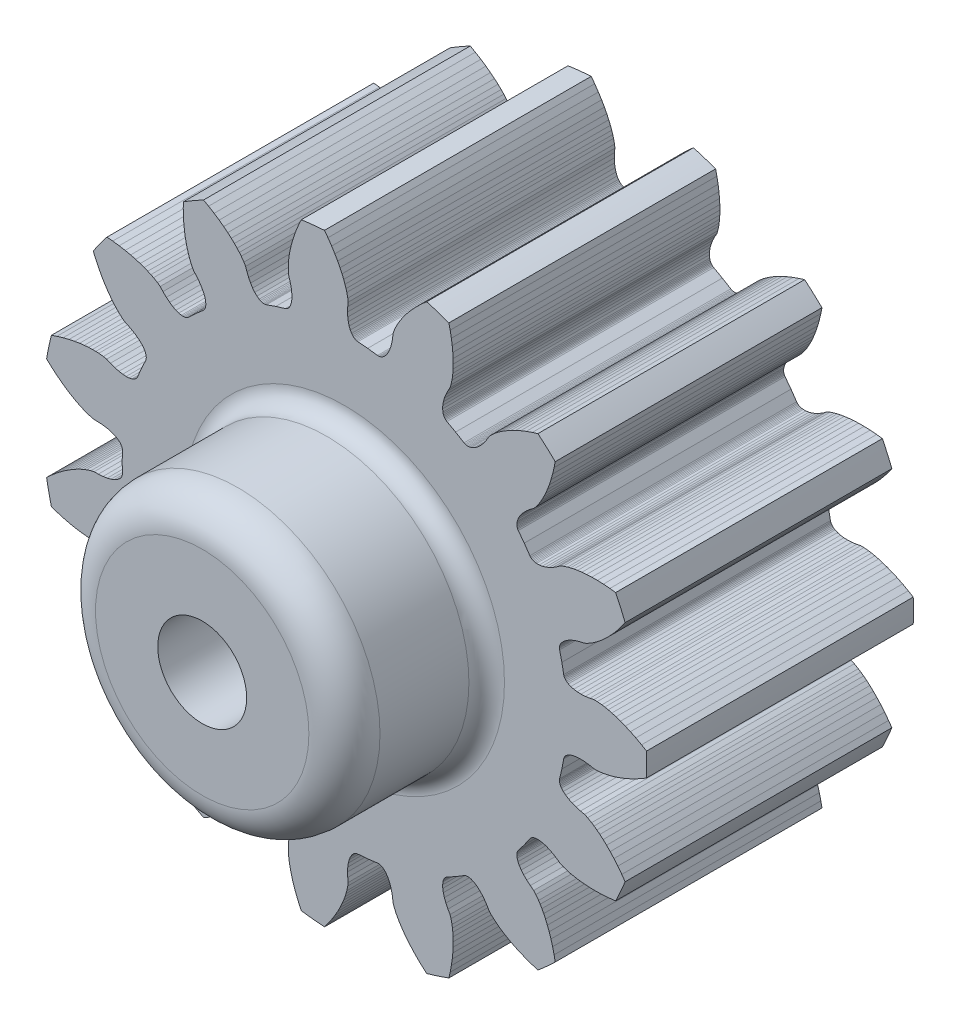
from build123d import *

# Parameters (mm, degrees)
SKETCH1_R           = 2.5
BOSS_EXTRUDE1_DEPTH = 15
SKETCH2_R           = 8
SKETCH2_R_2         = 2.5
BOSS_EXTRUDE2_DEPTH = 8
FILLET1_R           = 2
FILLET2_R           = 1
CUT_EXTRUDE1_REACH  = 84.132
SKETCH3_R           = 1.9


with BuildPart() as part:
    # Sketch1 → Boss-Extrude1 (new body)
    with BuildSketch(Plane.XY):
        with BuildLine():
            Line((75.597629629, 6.043555761), (75.375479429, 5.753315661))
            Line((75.375479429, 5.753315661), (75.157755329, 5.492273861))
            Line((75.157755329, 5.492273861), (74.944995729, 5.257896961))
            Line((74.944995729, 5.257896961), (74.741114529, 5.051395161))
            Line((74.741114529, 5.051395161), (74.547026629, 4.870580761))
            Line((74.547026629, 4.870580761), (74.362927029, 4.712949661))
            Line((74.362927029, 4.712949661), (74.194141129, 4.580237061))
            Line((74.194141129, 4.580237061), (74.038535129, 4.468053261))
            Line((74.038535129, 4.468053261), (73.898532829, 4.375768461))
            Line((73.898532829, 4.375768461), (73.673048429, 4.246083661))
            Line((73.673048429, 4.246083661), (73.505387029, 4.168683561))
            Line((73.505387029, 4.168683561), (73.275858929, 4.119394961))
            Line((73.275858929, 4.119394961), (73.022759329, 4.047194761))
            Line((73.022759329, 4.047194761), (72.799120629, 3.962118561))
            Line((72.799120629, 3.962118561), (72.605538229, 3.866511261))
            Line((72.605538229, 3.866511261), (72.442428929, 3.762741361))
            Line((72.442428929, 3.762741361), (72.310122729, 3.653199561))
            Line((72.310122729, 3.653199561), (72.208743829, 3.540284261))
            Line((72.208743829, 3.540284261), (72.169666629, 3.483304461))
            Line((72.169666629, 3.483304461), (72.138318329, 3.426372761))
            Line((72.138318329, 3.426372761), (72.114663929, 3.369798461))
            Line((72.114663929, 3.369798461), (72.098691929, 3.313875561))
            Line((72.098691929, 3.313875561), (72.090342029, 3.258887961))
            Line((72.090342029, 3.258887961), (72.089579129, 3.205144961))
            Line((72.089579129, 3.205144961), (72.099191729, 3.140153261))
            Line((72.099191729, 3.140153261), (72.226844929, 2.598896061))
            Line((72.226844929, 2.598896061), (72.330377029, 2.052511861))
            Line((72.330377029, 2.052511861), (72.348030029, 1.989229161))
            Line((72.348030029, 1.989229161), (72.370586129, 1.940442761))
            Line((72.370586129, 1.940442761), (72.400579629, 1.893605261))
            Line((72.400579629, 1.893605261), (72.437916729, 1.849013661))
            Line((72.437916729, 1.849013661), (72.482536929, 1.806951561))
            Line((72.482536929, 1.806951561), (72.534331229, 1.767692261))
            Line((72.534331229, 1.767692261), (72.593205729, 1.731532861))
            Line((72.593205729, 1.731532861), (72.731746829, 1.669614061))
            Line((72.731746829, 1.669614061), (72.897169229, 1.623356461))
            Line((72.897169229, 1.623356461), (73.088384029, 1.594900461))
            Line((73.088384029, 1.594900461), (73.304117329, 1.586295861))
            Line((73.304117329, 1.586295861), (73.543025129, 1.599536961))
            Line((73.543025129, 1.599536961), (73.803609529, 1.636523761))
            Line((73.803609529, 1.636523761), (74.033341329, 1.684853761))
            Line((74.033341329, 1.684853761), (74.217989129, 1.682339261))
            Line((74.217989129, 1.682339261), (74.476726929, 1.655579161))
            Line((74.476726929, 1.655579161), (74.642160929, 1.628216861))
            Line((74.642160929, 1.628216861), (74.829943429, 1.589022561))
            Line((74.829943429, 1.589022561), (75.038116029, 1.536434861))
            Line((75.038116029, 1.536434861), (75.270413829, 1.467311861))
            Line((75.270413829, 1.467311861), (75.521265729, 1.381072361))
            Line((75.521265729, 1.381072361), (75.791512329, 1.275349461))
            Line((75.791512329, 1.275349461), (76.081207529, 1.147772661))
            Line((76.081207529, 1.147772661), (76.386283729, 0.997855461))
            Line((76.386283729, 0.997855461), (76.707279329, 0.823064561))
            Line((76.707279329, 0.823064561), (76.987296229, 0.655979061))
            ThreePointArc((76.987296229, 0.655979061), (76.999957078, -3.9e-08), (76.987296229, -0.655979139))
            Line((76.987296229, -0.655979139), (76.707279378, -0.823064639))
            Line((76.707279378, -0.823064639), (76.386283778, -0.997855539))
            Line((76.386283778, -0.997855539), (76.081207578, -1.147772739))
            Line((76.081207578, -1.147772739), (75.791512378, -1.275349539))
            Line((75.791512378, -1.275349539), (75.521265778, -1.381072439))
            Line((75.521265778, -1.381072439), (75.270413878, -1.467311939))
            Line((75.270413878, -1.467311939), (75.038116078, -1.536434939))
            Line((75.038116078, -1.536434939), (74.829943478, -1.589022639))
            Line((74.829943478, -1.589022639), (74.642160978, -1.628216939))
            Line((74.642160978, -1.628216939), (74.476726978, -1.655579239))
            Line((74.476726978, -1.655579239), (74.217989178, -1.682339339))
            Line((74.217989178, -1.682339339), (74.033341378, -1.684853839))
            Line((74.033341378, -1.684853839), (73.803609578, -1.636523839))
            Line((73.803609578, -1.636523839), (73.543025178, -1.599537039))
            Line((73.543025178, -1.599537039), (73.304117378, -1.586295939))
            Line((73.304117378, -1.586295939), (73.088384078, -1.594900539))
            Line((73.088384078, -1.594900539), (72.897169278, -1.623356539))
            Line((72.897169278, -1.623356539), (72.731746878, -1.669614139))
            Line((72.731746878, -1.669614139), (72.593205778, -1.731532939))
            Line((72.593205778, -1.731532939), (72.534331278, -1.767692339))
            Line((72.534331278, -1.767692339), (72.482536978, -1.806951639))
            Line((72.482536978, -1.806951639), (72.437916778, -1.849013739))
            Line((72.437916778, -1.849013739), (72.400579678, -1.893605339))
            Line((72.400579678, -1.893605339), (72.370586178, -1.940442839))
            Line((72.370586178, -1.940442839), (72.348030078, -1.989229239))
            Line((72.348030078, -1.989229239), (72.330377078, -2.052511939))
            Line((72.330377078, -2.052511939), (72.226844978, -2.598896139))
            Line((72.226844978, -2.598896139), (72.099191778, -3.140153339))
            Line((72.099191778, -3.140153339), (72.089579178, -3.205145039))
            Line((72.089579178, -3.205145039), (72.090342078, -3.258888039))
            Line((72.090342078, -3.258888039), (72.098691978, -3.313875639))
            Line((72.098691978, -3.313875639), (72.114663978, -3.369798539))
            Line((72.114663978, -3.369798539), (72.138318378, -3.426372839))
            Line((72.138318378, -3.426372839), (72.169666678, -3.483304539))
            Line((72.169666678, -3.483304539), (72.208743878, -3.540284339))
            Line((72.208743878, -3.540284339), (72.310122778, -3.653199639))
            Line((72.310122778, -3.653199639), (72.442428978, -3.762741439))
            Line((72.442428978, -3.762741439), (72.605538278, -3.866511339))
            Line((72.605538278, -3.866511339), (72.799120678, -3.962118639))
            Line((72.799120678, -3.962118639), (73.022759378, -4.047194839))
            Line((73.022759378, -4.047194839), (73.275858978, -4.119395039))
            Line((73.275858978, -4.119395039), (73.505387078, -4.168683639))
            Line((73.505387078, -4.168683639), (73.673048478, -4.246083739))
            Line((73.673048478, -4.246083739), (73.898532878, -4.375768539))
            Line((73.898532878, -4.375768539), (74.038535178, -4.468053339))
            Line((74.038535178, -4.468053339), (74.194141178, -4.580237139))
            Line((74.194141178, -4.580237139), (74.362927078, -4.712949739))
            Line((74.362927078, -4.712949739), (74.547026678, -4.870580839))
            Line((74.547026678, -4.870580839), (74.741114578, -5.051395239))
            Line((74.741114578, -5.051395239), (74.944995778, -5.257897039))
            Line((74.944995778, -5.257897039), (75.157755378, -5.492273939))
            Line((75.157755378, -5.492273939), (75.375479478, -5.753315739))
            Line((75.375479478, -5.753315739), (75.597629678, -6.043555839))
            Line((75.597629678, -6.043555839), (75.785478078, -6.310089139))
            ThreePointArc((75.785478078, -6.310089139), (75.530233591, -6.914505522), (75.25185658, -7.508622641))
            Line((75.25185658, -7.508622641), (74.928088625, -7.547369759))
            Line((74.928088625, -7.547369759), (74.563750725, -7.576488459))
            Line((74.563750725, -7.576488459), (74.224073025, -7.589358959))
            Line((74.224073025, -7.589358959), (73.907533025, -7.588076559))
            Line((73.907533025, -7.588076559), (73.617649125, -7.574739959))
            Line((73.617649125, -7.574739959), (73.353407725, -7.551493059))
            Line((73.353407725, -7.551493059), (73.113078325, -7.520156059))
            Line((73.113078325, -7.520156059), (72.901513825, -7.483525859))
            Line((72.901513825, -7.483525859), (72.714024225, -7.442953659))
            Line((72.714024225, -7.442953659), (72.551763425, -7.400662159))
            Line((72.551763425, -7.400662159), (72.304510425, -7.319870659))
            Line((72.304510425, -7.319870659), (72.134803525, -7.247064759))
            Line((72.134803525, -7.247064759), (71.944590625, -7.109472759))
            Line((71.944590625, -7.109472759), (71.721578825, -6.969694359))
            Line((71.721578825, -6.969694359), (71.508711425, -6.860425559))
            Line((71.508711425, -6.860425559), (71.308129425, -6.780539559))
            Line((71.308129425, -6.780539559), (71.121871825, -6.728761359))
            Line((71.121871825, -6.728761359), (70.951936325, -6.703736459))
            Line((70.951936325, -6.703736459), (70.800188125, -6.703952359))
            Line((70.800188125, -6.703952359), (70.731696225, -6.713039159))
            Line((70.731696225, -6.713039159), (70.668411625, -6.727837659))
            Line((70.668411625, -6.727837659), (70.610540725, -6.748114659))
            Line((70.610540725, -6.748114659), (70.558294625, -6.773664759))
            Line((70.558294625, -6.773664759), (70.511843725, -6.804253559))
            Line((70.511843725, -6.804253559), (70.471394425, -6.839647659))
            Line((70.471394425, -6.839647659), (70.429528225, -6.890279159))
            Line((70.429528225, -6.890279159), (70.112712425, -7.347315759))
            Line((70.112712425, -7.347315759), (69.775946325, -7.789857459))
            Line((69.775946325, -7.789857459), (69.740730325, -7.845320559))
            Line((69.740730325, -7.845320559), (69.719567925, -7.894727559))
            Line((69.719567925, -7.894727559), (69.704830425, -7.948357459))
            Line((69.704830425, -7.948357459), (69.696675725, -8.005941859))
            Line((69.696675725, -8.005941859), (69.695274325, -8.067246259))
            Line((69.695274325, -8.067246259), (69.700756125, -8.132006459))
            Line((69.700756125, -8.132006459), (69.713279125, -8.199954159))
            Line((69.713279125, -8.199954159), (69.759966625, -8.344341959))
            Line((69.759966625, -8.344341959), (69.836279725, -8.498227159))
            Line((69.836279725, -8.498227159), (69.943080525, -8.659368259))
            Line((69.943080525, -8.659368259), (70.081039825, -8.825446959))
            Line((70.081039825, -8.825446959), (70.250740325, -8.994129959))
            Line((70.250740325, -8.994129959), (70.452591825, -9.163032959))
            Line((70.452591825, -9.163032959), (70.642228625, -9.301417859))
            Line((70.642228625, -9.301417859), (70.763913525, -9.440320359))
            Line((70.763913525, -9.440320359), (70.917156225, -9.650506059))
            Line((70.917156225, -9.650506059), (71.007519025, -9.791756459))
            Line((71.007519025, -9.791756459), (71.104043025, -9.957532159))
            Line((71.104043025, -9.957532159), (71.204257425, -10.147422559))
            Line((71.204257425, -10.147422559), (71.308326525, -10.366305859))
            Line((71.308326525, -10.366305859), (71.412090825, -10.610430659))
            Line((71.412090825, -10.610430659), (71.514353625, -10.882005359))
            Line((71.514353625, -10.882005359), (71.613389525, -11.182656459))
            Line((71.613389525, -11.182656459), (71.706115225, -11.509686359))
            Line((71.706115225, -11.509686359), (71.791008225, -11.865190559))
            Line((71.791008225, -11.865190559), (71.854207325, -12.185085659))
            ThreePointArc((71.854207325, -12.185085659), (71.375191584, -12.633430207), (70.879232318, -13.062957064))
            Line((70.879232318, -13.062957064), (70.56769582, -12.966666054))
            Line((70.56769582, -12.966666054), (70.22301292, -12.845077754))
            Line((70.22301292, -12.845077754), (69.90746692, -12.718676054))
            Line((69.90746692, -12.718676054), (69.61881492, -12.588756154))
            Line((69.61881492, -12.588756154), (69.35941722, -12.458666254))
            Line((69.35941722, -12.458666254), (69.12747612, -12.329952354))
            Line((69.12747612, -12.329952354), (68.92067012, -12.203573854))
            Line((68.92067012, -12.203573854), (68.74229522, -12.084059454))
            Line((68.74229522, -12.084059454), (68.58751712, -11.970736054))
            Line((68.58751712, -11.970736054), (68.45648602, -11.866103454))
            Line((68.45648602, -11.866103454), (68.26347002, -11.691729854))
            Line((68.26347002, -11.691729854), (68.13804782, -11.556192354))
            Line((68.13804782, -11.556192354), (68.02024352, -11.353129254))
            Line((68.02024352, -11.353129254), (67.87336502, -11.134728254))
            Line((67.87336502, -11.134728254), (67.72334462, -10.948325254))
            Line((67.72334462, -10.948325254), (67.57259642, -10.793761754))
            Line((67.57259642, -10.793761754), (67.42350172, -10.670702254))
            Line((67.42350172, -10.670702254), (67.27843652, -10.578721754))
            Line((67.27843652, -10.578721754), (67.13971982, -10.517197454))
            Line((67.13971982, -10.517197454), (67.07345332, -10.497640554))
            Line((67.07345332, -10.497640554), (67.00962082, -10.485419454))
            Line((67.00962082, -10.485419454), (66.94850582, -10.480405154))
            Line((66.94850582, -10.480405154), (66.89038442, -10.482495954))
            Line((66.89038442, -10.482495954), (66.83550782, -10.491546854))
            Line((66.83550782, -10.491546854), (66.78415942, -10.507428854))
            Line((66.78415942, -10.507428854), (66.72531912, -10.536654554))
            Line((66.72531912, -10.536654554), (66.25000002, -10.825317554))
            Line((66.25000002, -10.825317554), (65.76235092, -11.092624554))
            Line((65.76235092, -11.092624554), (65.70762062, -11.128968854))
            Line((65.70762062, -11.128968854), (65.66819222, -11.165496854))
            Line((65.66819222, -11.165496854), (65.63291562, -11.208495954))
            Line((65.63291562, -11.208495954), (65.60204422, -11.257785154))
            Line((65.60204422, -11.257785154), (65.57582922, -11.313219454))
            Line((65.57582922, -11.313219454), (65.55449672, -11.374610554))
            Line((65.55449672, -11.374610554), (65.53830022, -11.441777454))
            Line((65.53830022, -11.441777454), (65.52222352, -11.592671754))
            Line((65.52222352, -11.592671754), (65.52934832, -11.764292254))
            Line((65.52934832, -11.764292254), (65.56137362, -11.954941754))
            Line((65.56137362, -11.954941754), (65.61985542, -12.162775254))
            Line((65.61985542, -12.162775254), (65.70627502, -12.385898254))
            Line((65.70627502, -12.385898254), (65.82197652, -12.622299254))
            Line((65.82197652, -12.622299254), (65.93893222, -12.825852354))
            Line((65.93893222, -12.825852354), (65.99360002, -13.002239854))
            Line((65.99360002, -13.002239854), (66.04810402, -13.256583454))
            Line((66.04810402, -13.256583454), (66.07320292, -13.422376054))
            Line((66.07320292, -13.422376054), (66.09395482, -13.613079454))
            Line((66.09395482, -13.613079454), (66.10826992, -13.827313854))
            Line((66.10826992, -13.827313854), (66.11431392, -14.069602354))
            Line((66.11431392, -14.069602354), (66.10981282, -14.334826254))
            Line((66.10981282, -14.334826254), (66.09277512, -14.624516154))
            Line((66.09277512, -14.624516154), (66.06096312, -14.939456054))
            Line((66.06096312, -14.939456054), (66.01265712, -15.275927754))
            Line((66.01265712, -15.275927754), (65.94561422, -15.635226054))
            Line((65.94561422, -15.635226054), (65.87323642, -15.953170154))
            ThreePointArc((65.87323642, -15.953170154), (65.253275643, -16.167920036), (64.62549003, -16.358587552))
            Line((64.62549003, -16.358587552), (64.380052313, -16.143907932))
            Line((64.380052313, -16.143907932), (64.114623213, -15.892636332))
            Line((64.114623213, -15.892636332), (63.877769813, -15.648818532))
            Line((63.877769813, -15.648818532), (63.666916313, -15.412725432))
            Line((63.666916313, -15.412725432), (63.482857013, -15.188375832))
            Line((63.482857013, -15.188375832), (63.323320913, -14.976450932))
            Line((63.323320913, -14.976450932), (63.185797013, -14.776882832))
            Line((63.185797013, -14.776882832), (63.071454313, -14.595149432))
            Line((63.071454313, -14.595149432), (62.976150313, -14.428669332))
            Line((62.976150313, -14.428669332), (62.899005313, -14.279787632))
            Line((62.899005313, -14.279787632), (62.793600513, -14.041982732))
            Line((62.793600513, -14.041982732), (62.734149813, -13.867149232))
            Line((62.734149813, -13.867149232), (62.709123313, -13.633726532))
            Line((62.709123313, -13.633726532), (62.663774913, -13.374466432))
            Line((62.663774913, -13.374466432), (62.602541313, -13.143160032))
            Line((62.602541313, -13.143160032), (62.527692613, -12.940644432))
            Line((62.527692613, -12.940644432), (62.441540713, -12.767581732))
            Line((62.441540713, -12.767581732), (62.346428813, -12.624550032))
            Line((62.346428813, -12.624550032), (62.244729013, -12.511923632))
            Line((62.244729013, -12.511923632), (62.192146113, -12.467104432))
            Line((62.192146113, -12.467104432), (62.138803013, -12.429976932))
            Line((62.138803013, -12.429976932), (62.085011113, -12.400538432))
            Line((62.085011113, -12.400538432), (62.031064213, -12.378808432))
            Line((62.031064213, -12.378808432), (61.977250613, -12.364756532))
            Line((61.977250613, -12.364756532), (61.923881713, -12.358380132))
            Line((61.923881713, -12.358380132), (61.858241313, -12.361146532))
            Line((61.858241313, -12.361146532), (61.306605813, -12.431523732))
            Line((61.306605813, -12.431523732), (60.752392613, -12.477375932))
            Line((60.752392613, -12.477375932), (60.687611413, -12.488317332))
            Line((60.687611413, -12.488317332), (60.636734513, -12.505650432))
            Line((60.636734513, -12.505650432), (60.587018413, -12.530583732))
            Line((60.587018413, -12.530583732), (60.538768313, -12.563055132))
            Line((60.538768313, -12.563055132), (60.492272513, -12.603034232))
            Line((60.492272513, -12.603034232), (60.447814313, -12.650441132))
            Line((60.447814313, -12.650441132), (60.405698913, -12.705213432))
            Line((60.405698913, -12.705213432), (60.329637813, -12.836523332))
            Line((60.329637813, -12.836523332), (60.266342313, -12.996204232))
            Line((60.266342313, -12.996204232), (60.218054813, -13.183397132))
            Line((60.218054813, -13.183397132), (60.186947113, -13.397049132))
            Line((60.186947113, -13.397049132), (60.175142913, -13.636032232))
            Line((60.175142913, -13.636032232), (60.184688613, -13.899055332))
            Line((60.184688613, -13.899055332), (60.208740413, -14.132580432))
            Line((60.208740413, -14.132580432), (60.186938713, -14.315953932))
            Line((60.186938713, -14.315953932), (60.133279713, -14.570477132))
            Line((60.133279713, -14.570477132), (60.088774813, -14.732144732))
            Line((60.088774813, -14.732144732), (60.030166513, -14.914801632))
            Line((60.030166513, -14.914801632), (59.956107013, -15.116336932))
            Line((59.956107013, -15.116336932), (59.863080913, -15.340136832))
            Line((59.863080913, -15.340136832), (59.751092613, -15.580600132))
            Line((59.751092613, -15.580600132), (59.617700513, -15.838315132))
            Line((59.617700513, -15.838315132), (59.460541113, -16.113088032))
            Line((59.460541113, -16.113088032), (59.279556113, -16.400822332))
            Line((59.279556113, -16.400822332), (59.072169613, -16.701788832))
            Line((59.072169613, -16.701788832), (58.876729613, -16.962806632))
            ThreePointArc((58.876729613, -16.962806632), (58.223020594, -16.906829626), (57.571958414, -16.825669634))
            Line((57.571958414, -16.825669634), (57.435058013, -16.52972153))
            Line((57.435058013, -16.52972153), (57.294777813, -16.19221373))
            Line((57.294777813, -16.19221373), (57.177571013, -15.87313823))
            Line((57.177571013, -15.87313823), (57.080974513, -15.57169453))
            Line((57.080974513, -15.57169453), (57.004079213, -15.29187733))
            Line((57.004079213, -15.29187733), (56.944533313, -15.03338513))
            Line((56.944533313, -15.03338513), (56.900070613, -14.79513463))
            Line((56.900070613, -14.79513463), (56.869531113, -14.58260543))
            Line((56.869531113, -14.58260543), (56.850180113, -14.39175473))
            Line((56.850180113, -14.39175473), (56.840260313, -14.22436683))
            Line((56.840260313, -14.22436683), (56.840692213, -13.96424923))
            Line((56.840692213, -13.96424923), (56.857492413, -13.78035013))
            Line((56.857492413, -13.78035013), (56.929571213, -13.55692863))
            Line((56.929571213, -13.55692863), (56.993593813, -13.30163793))
            Line((56.993593813, -13.30163793), (57.031735013, -13.06542303))
            Line((57.031735013, -13.06542303), (57.045727913, -12.84997213))
            Line((57.045727913, -12.84997213), (57.037415113, -12.65683033))
            Line((57.037415113, -12.65683033), (57.008702313, -12.48747893))
            Line((57.008702313, -12.48747893), (56.961604213, -12.34322453))
            Line((56.961604213, -12.34322453), (56.931796913, -12.28089283))
            Line((56.931796913, -12.28089283), (56.898166713, -12.22527853))
            Line((56.898166713, -12.22527853), (56.860999113, -12.17650603))
            Line((56.860999113, -12.17650603), (56.820554513, -12.13471243))
            Line((56.820554513, -12.13471243), (56.777108713, -12.09998743))
            Line((56.777108713, -12.09998743), (56.730947413, -12.07245523))
            Line((56.730947413, -12.07245523), (56.669856613, -12.04828413))
            Line((56.669856613, -12.04828413), (56.137287613, -11.88820653))
            Line((56.137287613, -11.88820653), (55.612338913, -11.70467573))
            Line((55.612338913, -11.70467573), (55.548708013, -11.68832233))
            Line((55.548708013, -11.68832233), (55.495179713, -11.68346343))
            Line((55.495179713, -11.68346343), (55.439620413, -11.68601973))
            Line((55.439620413, -11.68601973), (55.382334413, -11.69605873))
            Line((55.382334413, -11.69605873), (55.323597513, -11.71367003))
            Line((55.323597513, -11.71367003), (55.263700813, -11.73889553))
            Line((55.263700813, -11.73889553), (55.202948513, -11.77180263))
            Line((55.202948513, -11.77180263), (55.080054813, -11.86082333))
            Line((55.080054813, -11.86082333), (54.957283313, -11.98095453))
            Line((54.957283313, -11.98095453), (54.837032313, -12.13232343))
            Line((54.837032313, -12.13232343), (54.721713913, -12.31485163))
            Line((54.721713913, -12.31485163), (54.613727113, -12.52837233))
            Line((54.613727113, -12.52837233), (54.515466413, -12.77253843))
            Line((54.515466413, -12.77253843), (54.442455513, -12.99565703))
            Line((54.442455513, -12.99565703), (54.347954013, -13.15430953))
            Line((54.347954013, -13.15430953), (54.195410113, -13.36500293))
            Line((54.195410113, -13.36500293), (54.088996713, -13.49459193))
            Line((54.088996713, -13.49459193), (53.961162213, -13.63761913))
            Line((53.961162213, -13.63761913), (53.811533613, -13.79160813))
            Line((53.811533613, -13.79160813), (53.635522413, -13.95822233))
            Line((53.635522413, -13.95822233), (53.435410813, -14.13234673))
            Line((53.435410813, -14.13234673), (53.208728913, -14.31352563))
            Line((53.208728913, -14.31352563), (52.953396513, -14.50062063))
            Line((52.953396513, -14.50062063), (52.671026313, -14.68986583))
            Line((52.671026313, -14.68986583), (52.359155213, -14.88046073))
            Line((52.359155213, -14.88046073), (52.074446413, -15.03941973))
            ThreePointArc((52.074446413, -15.03941973), (51.500021442, -14.722394799), (50.93825732, -14.383440634))
            Line((50.93825732, -14.383440634), (50.933565412, -14.057396032))
            Line((50.933565412, -14.057396032), (50.942689912, -13.692010332))
            Line((50.942689912, -13.692010332), (50.965395912, -13.352848032))
            Line((50.965395912, -13.352848032), (50.999758812, -13.038176132))
            Line((50.999758812, -13.038176132), (51.043323312, -12.751274332))
            Line((51.043323312, -12.751274332), (51.094063712, -12.490910432))
            Line((51.094063712, -12.490910432), (51.150350212, -12.255173132))
            Line((51.150350212, -12.255173132), (51.208894312, -12.048596532))
            Line((51.208894312, -12.048596532), (51.268842312, -11.866375032))
            Line((51.268842312, -11.866375032), (51.327862912, -11.709423732))
            Line((51.327862912, -11.709423732), (51.434056812, -11.471970132))
            Line((51.434056812, -11.471970132), (51.524203112, -11.310803232))
            Line((51.524203112, -11.310803232), (51.680924112, -11.136014732))
            Line((51.680924112, -11.136014732), (51.843247812, -10.928835332))
            Line((51.843247812, -10.928835332), (51.974168712, -10.728555732))
            Line((51.974168712, -10.728555732), (52.074583612, -10.537422932))
            Line((52.074583612, -10.537422932), (52.145547412, -10.357598032))
            Line((52.145547412, -10.357598032), (52.188198312, -10.191209232))
            Line((52.188198312, -10.191209232), (52.203845612, -10.040269732))
            Line((52.203845612, -10.040269732), (52.201967912, -9.971203232))
            Line((52.201967912, -9.971203232), (52.193865512, -9.906718432))
            Line((52.193865512, -9.906718432), (52.179748812, -9.847045032))
            Line((52.179748812, -9.847045032), (52.159799812, -9.792414432))
            Line((52.159799812, -9.792414432), (52.134234112, -9.743020532))
            Line((52.134234112, -9.743020532), (52.103261912, -9.699093132))
            Line((52.103261912, -9.699093132), (52.057284012, -9.652163932))
            Line((52.057284012, -9.652163932), (51.635867412, -9.289310332))
            Line((51.635867412, -9.289310332), (51.230951612, -8.908130832))
            Line((51.230951612, -8.908130832), (51.179473412, -8.867310232))
            Line((51.179473412, -8.867310232), (51.132549212, -8.841099432))
            Line((51.132549212, -8.841099432), (51.080753512, -8.820836832))
            Line((51.080753512, -8.820836832), (51.024336912, -8.806707532))
            Line((51.024336912, -8.806707532), (50.963514912, -8.798905732))
            Line((50.963514912, -8.798905732), (50.898536412, -8.797588232))
            Line((50.898536412, -8.797588232), (50.829651912, -8.802940232))
            Line((50.829651912, -8.802940232), (50.681174912, -8.834279332))
            Line((50.681174912, -8.834279332), (50.520155912, -8.894088932))
            Line((50.520155912, -8.894088932), (50.348733812, -8.983460832))
            Line((50.348733812, -8.983460832), (50.169144312, -9.103304432))
            Line((50.169144312, -9.103304432), (49.983646712, -9.254443132))
            Line((49.983646712, -9.254443132), (49.794569812, -9.437533732))
            Line((49.794569812, -9.437533732), (49.637120612, -9.611666532))
            Line((49.637120612, -9.611666532), (49.486259412, -9.718165432))
            Line((49.486259412, -9.718165432), (49.261206912, -9.848598332))
            Line((49.261206912, -9.848598332), (49.111284812, -9.923701532))
            Line((49.111284812, -9.923701532), (48.936327712, -10.002368332))
            Line((48.936327712, -10.002368332), (48.737002312, -10.082184932))
            Line((48.737002312, -10.082184932), (48.508439912, -10.162804332))
            Line((48.508439912, -10.162804332), (48.254806212, -10.240482232))
            Line((48.254806212, -10.240482232), (47.974029712, -10.313797532))
            Line((47.974029712, -10.313797532), (47.664673612, -10.380864332))
            Line((47.664673612, -10.380864332), (47.329742712, -10.438898032))
            Line((47.329742712, -10.438898032), (46.967312312, -10.486165732))
            Line((46.967312312, -10.486165732), (46.642563512, -10.515580532))
            ThreePointArc((46.642563512, -10.515580532), (46.246745819, -9.99232412), (45.871413812, -9.454183985))
            Line((45.871413812, -9.454183985), (45.999741816, -9.154419097))
            Line((45.999741816, -9.154419097), (46.156693216, -8.824333897))
            Line((46.156693216, -8.824333897), (46.315385916, -8.523729097))
            Line((46.315385916, -8.523729097), (46.474766516, -8.250238697))
            Line((46.474766516, -8.250238697), (46.631258216, -8.005860097))
            Line((46.631258216, -8.005860097), (46.783511416, -7.788643897))
            Line((46.783511416, -7.788643897), (46.930814716, -7.596180897))
            Line((46.930814716, -7.596180897), (47.068319716, -7.431275797))
            Line((47.068319716, -7.431275797), (47.197201016, -7.289191197))
            Line((47.197201016, -7.289191197), (47.314956916, -7.169814897))
            Line((47.314956916, -7.169814897), (47.508550916, -6.996083197))
            Line((47.508550916, -6.996083197), (47.656456116, -6.885515697))
            Line((47.656456116, -6.885515697), (47.870720716, -6.789582597))
            Line((47.870720716, -6.789582597), (48.103278216, -6.666337897))
            Line((48.103278216, -6.666337897), (48.304341616, -6.536623697))
            Line((48.304341616, -6.536623697), (48.473815816, -6.402857597))
            Line((48.473815816, -6.402857597), (48.611785816, -6.267442897))
            Line((48.611785816, -6.267442897), (48.718425816, -6.132786897))
            Line((48.718425816, -6.132786897), (48.794113016, -6.001261197))
            Line((48.794113016, -6.001261197), (48.820489516, -5.937401997))
            Line((48.820489516, -5.937401997), (48.839315916, -5.875196597))
            Line((48.839315916, -5.875196597), (48.850691016, -5.814940497))
            Line((48.850691016, -5.814940497), (48.854687016, -5.756918997))
            Line((48.854687016, -5.756918997), (48.851421816, -5.701396897))
            Line((48.851421816, -5.701396897), (48.840994216, -5.648669697))
            Line((48.840994216, -5.648669697), (48.818079216, -5.587096797))
            Line((48.818079216, -5.587096797), (48.580681816, -5.084207997))
            Line((48.580681816, -5.084207997), (48.365812416, -4.571289097))
            Line((48.365812416, -4.571289097), (48.335388016, -4.513059597))
            Line((48.335388016, -4.513059597), (48.303181516, -4.470028997))
            Line((48.303181516, -4.470028997), (48.264105416, -4.430450997))
            Line((48.264105416, -4.430450997), (48.218313116, -4.394596597))
            Line((48.218313116, -4.394596597), (48.165922716, -4.362730797))
            Line((48.165922716, -4.362730797), (48.107097816, -4.335097997))
            Line((48.107097816, -4.335097997), (48.041991916, -4.311969397))
            Line((48.041991916, -4.311969397), (47.893604616, -4.280208097))
            Line((47.893604616, -4.280208097), (47.722179616, -4.269354597))
            Line((47.722179616, -4.269354597), (47.529226916, -4.281276197))
            Line((47.529226916, -4.281276197), (47.316418916, -4.317713097))
            Line((47.316418916, -4.317713097), (47.085484916, -4.380336497))
            Line((47.085484916, -4.380336497), (46.838284916, -4.470693597))
            Line((46.838284916, -4.470693597), (46.623621616, -4.565731497))
            Line((46.623621616, -4.565731497), (46.442486016, -4.601662297))
            Line((46.442486016, -4.601662297), (46.183838516, -4.629281597))
            Line((46.183838516, -4.629281597), (46.016330716, -4.636912897))
            Line((46.016330716, -4.636912897), (45.824502716, -4.637617197))
            Line((45.824502716, -4.637617197), (45.609945616, -4.629460297))
            Line((45.609945616, -4.629460297), (45.368352616, -4.610145097))
            Line((45.368352616, -4.610145097), (45.105052216, -4.577945197))
            Line((45.105052216, -4.577945197), (44.818730116, -4.530720097))
            Line((44.818730116, -4.530720097), (44.508840716, -4.466162097))
            Line((44.508840716, -4.466162097), (44.179261716, -4.382949897))
            Line((44.179261716, -4.382949897), (43.828939516, -4.278717397))
            Line((43.828939516, -4.278717397), (43.520302616, -4.173501897))
            ThreePointArc((43.520302616, -4.173501897), (43.371532736, -3.534489832), (43.247531217, -2.890213091))
            Line((43.247531217, -2.890213091), (43.48669, -2.66856))
            Line((43.48669, -2.66856), (43.76433, -2.43085))
            Line((43.76433, -2.43085), (44.03157, -2.22078))
            Line((44.03157, -2.22078), (44.28841, -2.03576))
            Line((44.28841, -2.03576), (44.53077, -1.87616))
            Line((44.53077, -1.87616), (44.75821, -1.73965))
            Line((44.75821, -1.73965), (44.97106, -1.62374))
            Line((44.97106, -1.62374), (45.16375, -1.52902))
            Line((45.16375, -1.52902), (45.33928, -1.45164))
            Line((45.33928, -1.45164), (45.49541, -1.39048))
            Line((45.49541, -1.39048), (45.74293, -1.31051))
            Line((45.74293, -1.31051), (45.92302, -1.26966))
            Line((45.92302, -1.26966), (46.15778, -1.26917))
            Line((46.15778, -1.26917), (46.42036, -1.25117))
            Line((46.42036, -1.25117), (46.6568, -1.21445))
            Line((46.6568, -1.21445), (46.86603, -1.16118))
            Line((46.86603, -1.16118), (47.04715, -1.09359))
            Line((47.04715, -1.09359), (47.19934, -1.01395))
            Line((47.19934, -1.01395), (47.32198, -0.92458))
            Line((47.32198, -0.92458), (47.37205, -0.87697))
            Line((47.37205, -0.87697), (47.41455, -0.8278))
            Line((47.41455, -0.8278), (47.44945, -0.77738))
            Line((47.44945, -0.77738), (47.4767, -0.726))
            Line((47.4767, -0.726), (47.4963, -0.67395))
            Line((47.4963, -0.67395), (47.50822, -0.62154))
            Line((47.50822, -0.62154), (47.51233, -0.55597))
            Line((47.51233, -0.55597), (47.5, 0))
            Line((47.5, 0), (47.51233, 0.55597))
            Line((47.51233, 0.55597), (47.50822, 0.62154))
            Line((47.50822, 0.62154), (47.4963, 0.67395))
            Line((47.4963, 0.67395), (47.4767, 0.726))
            Line((47.4767, 0.726), (47.44945, 0.77738))
            Line((47.44945, 0.77738), (47.41455, 0.8278))
            Line((47.41455, 0.8278), (47.37205, 0.87697))
            Line((47.37205, 0.87697), (47.32198, 0.92458))
            Line((47.32198, 0.92458), (47.19934, 1.01395))
            Line((47.19934, 1.01395), (47.04715, 1.09359))
            Line((47.04715, 1.09359), (46.86603, 1.16118))
            Line((46.86603, 1.16118), (46.6568, 1.21445))
            Line((46.6568, 1.21445), (46.42036, 1.25117))
            Line((46.42036, 1.25117), (46.15778, 1.26917))
            Line((46.15778, 1.26917), (45.92302, 1.26966))
            Line((45.92302, 1.26966), (45.74293, 1.31051))
            Line((45.74293, 1.31051), (45.49541, 1.39048))
            Line((45.49541, 1.39048), (45.33928, 1.45164))
            Line((45.33928, 1.45164), (45.16375, 1.52902))
            Line((45.16375, 1.52902), (44.97106, 1.62374))
            Line((44.97106, 1.62374), (44.75821, 1.73965))
            Line((44.75821, 1.73965), (44.53077, 1.87616))
            Line((44.53077, 1.87616), (44.28841, 2.03576))
            Line((44.28841, 2.03576), (44.03157, 2.22078))
            Line((44.03157, 2.22078), (43.76433, 2.43085))
            Line((43.76433, 2.43085), (43.48669, 2.66856))
            Line((43.48669, 2.66856), (43.2475312, 2.8902131))
            ThreePointArc((43.2475312, 2.8902131), (43.371532719, 3.534489839), (43.520302598, 4.173501902))
            Line((43.520302598, 4.173501902), (43.828939482, 4.278717404))
            Line((43.828939482, 4.278717404), (44.179261682, 4.382949904))
            Line((44.179261682, 4.382949904), (44.508840682, 4.466162104))
            Line((44.508840682, 4.466162104), (44.818730082, 4.530720104))
            Line((44.818730082, 4.530720104), (45.105052182, 4.577945204))
            Line((45.105052182, 4.577945204), (45.368352582, 4.610145104))
            Line((45.368352582, 4.610145104), (45.609945582, 4.629460304))
            Line((45.609945582, 4.629460304), (45.824502682, 4.637617204))
            Line((45.824502682, 4.637617204), (46.016330682, 4.636912904))
            Line((46.016330682, 4.636912904), (46.183838482, 4.629281604))
            Line((46.183838482, 4.629281604), (46.442485982, 4.601662304))
            Line((46.442485982, 4.601662304), (46.623621582, 4.565731504))
            Line((46.623621582, 4.565731504), (46.838284882, 4.470693604))
            Line((46.838284882, 4.470693604), (47.085484882, 4.380336504))
            Line((47.085484882, 4.380336504), (47.316418882, 4.317713104))
            Line((47.316418882, 4.317713104), (47.529226882, 4.281276204))
            Line((47.529226882, 4.281276204), (47.722179582, 4.269354604))
            Line((47.722179582, 4.269354604), (47.893604582, 4.280208104))
            Line((47.893604582, 4.280208104), (48.041991882, 4.311969404))
            Line((48.041991882, 4.311969404), (48.107097782, 4.335098004))
            Line((48.107097782, 4.335098004), (48.165922682, 4.362730804))
            Line((48.165922682, 4.362730804), (48.218313082, 4.394596604))
            Line((48.218313082, 4.394596604), (48.264105382, 4.430451004))
            Line((48.264105382, 4.430451004), (48.303181482, 4.470029004))
            Line((48.303181482, 4.470029004), (48.335387982, 4.513059604))
            Line((48.335387982, 4.513059604), (48.365812382, 4.571289104))
            Line((48.365812382, 4.571289104), (48.580681782, 5.084208004))
            Line((48.580681782, 5.084208004), (48.818079182, 5.587096804))
            Line((48.818079182, 5.587096804), (48.840994182, 5.648669704))
            Line((48.840994182, 5.648669704), (48.851421782, 5.701396904))
            Line((48.851421782, 5.701396904), (48.854686982, 5.756919004))
            Line((48.854686982, 5.756919004), (48.850690982, 5.814940504))
            Line((48.850690982, 5.814940504), (48.839315882, 5.875196604))
            Line((48.839315882, 5.875196604), (48.820489482, 5.937402004))
            Line((48.820489482, 5.937402004), (48.794112982, 6.001261204))
            Line((48.794112982, 6.001261204), (48.718425782, 6.132786904))
            Line((48.718425782, 6.132786904), (48.611785782, 6.267442904))
            Line((48.611785782, 6.267442904), (48.473815782, 6.402857604))
            Line((48.473815782, 6.402857604), (48.304341582, 6.536623704))
            Line((48.304341582, 6.536623704), (48.103278182, 6.666337904))
            Line((48.103278182, 6.666337904), (47.870720682, 6.789582604))
            Line((47.870720682, 6.789582604), (47.656456082, 6.885515704))
            Line((47.656456082, 6.885515704), (47.508550882, 6.996083204))
            Line((47.508550882, 6.996083204), (47.314956882, 7.169814904))
            Line((47.314956882, 7.169814904), (47.197200982, 7.289191204))
            Line((47.197200982, 7.289191204), (47.068319682, 7.431275804))
            Line((47.068319682, 7.431275804), (46.930814682, 7.596180904))
            Line((46.930814682, 7.596180904), (46.783511382, 7.788643904))
            Line((46.783511382, 7.788643904), (46.631258182, 8.005860104))
            Line((46.631258182, 8.005860104), (46.474766482, 8.250238704))
            Line((46.474766482, 8.250238704), (46.315385882, 8.523729104))
            Line((46.315385882, 8.523729104), (46.156693182, 8.824333904))
            Line((46.156693182, 8.824333904), (45.999741782, 9.154419104))
            Line((45.999741782, 9.154419104), (45.871413782, 9.454184004))
            ThreePointArc((45.871413782, 9.454184004), (46.246745787, 9.992324112), (46.642563476, 10.515580498))
            Line((46.642563476, 10.515580498), (46.967312279, 10.486165706))
            Line((46.967312279, 10.486165706), (47.329742679, 10.438898006))
            Line((47.329742679, 10.438898006), (47.664673579, 10.380864306))
            Line((47.664673579, 10.380864306), (47.974029679, 10.313797506))
            Line((47.974029679, 10.313797506), (48.254806179, 10.240482206))
            Line((48.254806179, 10.240482206), (48.508439879, 10.162804306))
            Line((48.508439879, 10.162804306), (48.737002279, 10.082184906))
            Line((48.737002279, 10.082184906), (48.936327679, 10.002368306))
            Line((48.936327679, 10.002368306), (49.111284779, 9.923701506))
            Line((49.111284779, 9.923701506), (49.261206879, 9.848598306))
            Line((49.261206879, 9.848598306), (49.486259379, 9.718165406))
            Line((49.486259379, 9.718165406), (49.637120579, 9.611666506))
            Line((49.637120579, 9.611666506), (49.794569779, 9.437533706))
            Line((49.794569779, 9.437533706), (49.983646679, 9.254443106))
            Line((49.983646679, 9.254443106), (50.169144279, 9.103304406))
            Line((50.169144279, 9.103304406), (50.348733779, 8.983460806))
            Line((50.348733779, 8.983460806), (50.520155879, 8.894088906))
            Line((50.520155879, 8.894088906), (50.681174879, 8.834279306))
            Line((50.681174879, 8.834279306), (50.829651879, 8.802940206))
            Line((50.829651879, 8.802940206), (50.898536379, 8.797588206))
            Line((50.898536379, 8.797588206), (50.963514879, 8.798905706))
            Line((50.963514879, 8.798905706), (51.024336879, 8.806707506))
            Line((51.024336879, 8.806707506), (51.080753479, 8.820836806))
            Line((51.080753479, 8.820836806), (51.132549179, 8.841099406))
            Line((51.132549179, 8.841099406), (51.179473379, 8.867310206))
            Line((51.179473379, 8.867310206), (51.230951579, 8.908130806))
            Line((51.230951579, 8.908130806), (51.635867379, 9.289310306))
            Line((51.635867379, 9.289310306), (52.057283979, 9.652163906))
            Line((52.057283979, 9.652163906), (52.103261879, 9.699093106))
            Line((52.103261879, 9.699093106), (52.134234079, 9.743020506))
            Line((52.134234079, 9.743020506), (52.159799779, 9.792414406))
            Line((52.159799779, 9.792414406), (52.179748779, 9.847045006))
            Line((52.179748779, 9.847045006), (52.193865479, 9.906718406))
            Line((52.193865479, 9.906718406), (52.201967879, 9.971203206))
            Line((52.201967879, 9.971203206), (52.203845579, 10.040269706))
            Line((52.203845579, 10.040269706), (52.188198279, 10.191209206))
            Line((52.188198279, 10.191209206), (52.145547379, 10.357598006))
            Line((52.145547379, 10.357598006), (52.074583579, 10.537422906))
            Line((52.074583579, 10.537422906), (51.974168679, 10.728555706))
            Line((51.974168679, 10.728555706), (51.843247779, 10.928835306))
            Line((51.843247779, 10.928835306), (51.680924079, 11.136014706))
            Line((51.680924079, 11.136014706), (51.524203079, 11.310803206))
            Line((51.524203079, 11.310803206), (51.434056779, 11.471970106))
            Line((51.434056779, 11.471970106), (51.327862879, 11.709423706))
            Line((51.327862879, 11.709423706), (51.268842279, 11.866375006))
            Line((51.268842279, 11.866375006), (51.208894279, 12.048596506))
            Line((51.208894279, 12.048596506), (51.150350179, 12.255173106))
            Line((51.150350179, 12.255173106), (51.094063679, 12.490910406))
            Line((51.094063679, 12.490910406), (51.043323279, 12.751274306))
            Line((51.043323279, 12.751274306), (50.999758779, 13.038176106))
            Line((50.999758779, 13.038176106), (50.965395879, 13.352848006))
            Line((50.965395879, 13.352848006), (50.942689879, 13.692010306))
            Line((50.942689879, 13.692010306), (50.933565379, 14.057396006))
            Line((50.933565379, 14.057396006), (50.938257279, 14.383440606))
            ThreePointArc((50.938257279, 14.383440606), (51.500021407, 14.722394774), (52.074446384, 15.039419709))
            Line((52.074446384, 15.039419709), (52.359155178, 14.880460709))
            Line((52.359155178, 14.880460709), (52.671026278, 14.689865809))
            Line((52.671026278, 14.689865809), (52.953396478, 14.500620609))
            Line((52.953396478, 14.500620609), (53.208728878, 14.313525609))
            Line((53.208728878, 14.313525609), (53.435410778, 14.132346709))
            Line((53.435410778, 14.132346709), (53.635522378, 13.958222309))
            Line((53.635522378, 13.958222309), (53.811533578, 13.791608109))
            Line((53.811533578, 13.791608109), (53.961162178, 13.637619109))
            Line((53.961162178, 13.637619109), (54.088996678, 13.494591909))
            Line((54.088996678, 13.494591909), (54.195410078, 13.365002909))
            Line((54.195410078, 13.365002909), (54.347953978, 13.154309509))
            Line((54.347953978, 13.154309509), (54.442455478, 12.995657009))
            Line((54.442455478, 12.995657009), (54.515466378, 12.772538409))
            Line((54.515466378, 12.772538409), (54.613727078, 12.528372309))
            Line((54.613727078, 12.528372309), (54.721713878, 12.314851609))
            Line((54.721713878, 12.314851609), (54.837032278, 12.132323409))
            Line((54.837032278, 12.132323409), (54.957283278, 11.980954509))
            Line((54.957283278, 11.980954509), (55.080054778, 11.860823309))
            Line((55.080054778, 11.860823309), (55.202948478, 11.771802609))
            Line((55.202948478, 11.771802609), (55.263700778, 11.738895509))
            Line((55.263700778, 11.738895509), (55.323597478, 11.713670009))
            Line((55.323597478, 11.713670009), (55.382334378, 11.696058709))
            Line((55.382334378, 11.696058709), (55.439620378, 11.686019709))
            Line((55.439620378, 11.686019709), (55.495179678, 11.683463409))
            Line((55.495179678, 11.683463409), (55.548707978, 11.688322309))
            Line((55.548707978, 11.688322309), (55.612338878, 11.704675709))
            Line((55.612338878, 11.704675709), (56.137287578, 11.888206509))
            Line((56.137287578, 11.888206509), (56.669856578, 12.048284109))
            Line((56.669856578, 12.048284109), (56.730947378, 12.072455209))
            Line((56.730947378, 12.072455209), (56.777108678, 12.099987409))
            Line((56.777108678, 12.099987409), (56.820554478, 12.134712409))
            Line((56.820554478, 12.134712409), (56.860999078, 12.176506009))
            Line((56.860999078, 12.176506009), (56.898166678, 12.225278509))
            Line((56.898166678, 12.225278509), (56.931796878, 12.280892809))
            Line((56.931796878, 12.280892809), (56.961604178, 12.343224509))
            Line((56.961604178, 12.343224509), (57.008702278, 12.487478909))
            Line((57.008702278, 12.487478909), (57.037415078, 12.656830309))
            Line((57.037415078, 12.656830309), (57.045727878, 12.849972109))
            Line((57.045727878, 12.849972109), (57.031734978, 13.065423009))
            Line((57.031734978, 13.065423009), (56.993593778, 13.301637909))
            Line((56.993593778, 13.301637909), (56.929571178, 13.556928609))
            Line((56.929571178, 13.556928609), (56.857492378, 13.780350109))
            Line((56.857492378, 13.780350109), (56.840692178, 13.964249209))
            Line((56.840692178, 13.964249209), (56.840260278, 14.224366809))
            Line((56.840260278, 14.224366809), (56.850180078, 14.391754709))
            Line((56.850180078, 14.391754709), (56.869531078, 14.582605409))
            Line((56.869531078, 14.582605409), (56.900070578, 14.795134609))
            Line((56.900070578, 14.795134609), (56.944533278, 15.033385109))
            Line((56.944533278, 15.033385109), (57.004079178, 15.291877309))
            Line((57.004079178, 15.291877309), (57.080974478, 15.571694509))
            Line((57.080974478, 15.571694509), (57.177570978, 15.873138209))
            Line((57.177570978, 15.873138209), (57.294777778, 16.192213709))
            Line((57.294777778, 16.192213709), (57.435057978, 16.529721509))
            Line((57.435057978, 16.529721509), (57.571958378, 16.825669609))
            ThreePointArc((57.571958378, 16.825669609), (58.223020551, 16.9068296), (58.876729563, 16.962806606))
            Line((58.876729563, 16.962806606), (59.072169578, 16.701788805))
            Line((59.072169578, 16.701788805), (59.279556078, 16.400822305))
            Line((59.279556078, 16.400822305), (59.460541078, 16.113088005))
            Line((59.460541078, 16.113088005), (59.617700478, 15.838315105))
            Line((59.617700478, 15.838315105), (59.751092578, 15.580600105))
            Line((59.751092578, 15.580600105), (59.863080878, 15.340136805))
            Line((59.863080878, 15.340136805), (59.956106978, 15.116336905))
            Line((59.956106978, 15.116336905), (60.030166478, 14.914801605))
            Line((60.030166478, 14.914801605), (60.088774778, 14.732144705))
            Line((60.088774778, 14.732144705), (60.133279678, 14.570477105))
            Line((60.133279678, 14.570477105), (60.186938678, 14.315953905))
            Line((60.186938678, 14.315953905), (60.208740378, 14.132580405))
            Line((60.208740378, 14.132580405), (60.184688578, 13.899055305))
            Line((60.184688578, 13.899055305), (60.175142878, 13.636032205))
            Line((60.175142878, 13.636032205), (60.186947078, 13.397049105))
            Line((60.186947078, 13.397049105), (60.218054778, 13.183397105))
            Line((60.218054778, 13.183397105), (60.266342278, 12.996204205))
            Line((60.266342278, 12.996204205), (60.329637778, 12.836523305))
            Line((60.329637778, 12.836523305), (60.405698878, 12.705213405))
            Line((60.405698878, 12.705213405), (60.447814278, 12.650441105))
            Line((60.447814278, 12.650441105), (60.492272478, 12.603034205))
            Line((60.492272478, 12.603034205), (60.538768278, 12.563055105))
            Line((60.538768278, 12.563055105), (60.587018378, 12.530583705))
            Line((60.587018378, 12.530583705), (60.636734478, 12.505650405))
            Line((60.636734478, 12.505650405), (60.687611378, 12.488317305))
            Line((60.687611378, 12.488317305), (60.752392578, 12.477375905))
            Line((60.752392578, 12.477375905), (61.306605778, 12.431523705))
            Line((61.306605778, 12.431523705), (61.858241278, 12.361146505))
            Line((61.858241278, 12.361146505), (61.923881678, 12.358380105))
            Line((61.923881678, 12.358380105), (61.977250578, 12.364756505))
            Line((61.977250578, 12.364756505), (62.031064178, 12.378808405))
            Line((62.031064178, 12.378808405), (62.085011078, 12.400538405))
            Line((62.085011078, 12.400538405), (62.138802978, 12.429976905))
            Line((62.138802978, 12.429976905), (62.192146078, 12.467104405))
            Line((62.192146078, 12.467104405), (62.244728978, 12.511923605))
            Line((62.244728978, 12.511923605), (62.346428778, 12.624550005))
            Line((62.346428778, 12.624550005), (62.441540678, 12.767581705))
            Line((62.441540678, 12.767581705), (62.527692578, 12.940644405))
            Line((62.527692578, 12.940644405), (62.602541278, 13.143160005))
            Line((62.602541278, 13.143160005), (62.663774878, 13.374466405))
            Line((62.663774878, 13.374466405), (62.709123278, 13.633726505))
            Line((62.709123278, 13.633726505), (62.734149778, 13.867149205))
            Line((62.734149778, 13.867149205), (62.793600478, 14.041982705))
            Line((62.793600478, 14.041982705), (62.899005278, 14.279787605))
            Line((62.899005278, 14.279787605), (62.976150278, 14.428669305))
            Line((62.976150278, 14.428669305), (63.071454278, 14.595149405))
            Line((63.071454278, 14.595149405), (63.185796978, 14.776882805))
            Line((63.185796978, 14.776882805), (63.323320878, 14.976450905))
            Line((63.323320878, 14.976450905), (63.482856978, 15.188375805))
            Line((63.482856978, 15.188375805), (63.666916278, 15.412725405))
            Line((63.666916278, 15.412725405), (63.877769778, 15.648818505))
            Line((63.877769778, 15.648818505), (64.114623178, 15.892636305))
            Line((64.114623178, 15.892636305), (64.380052278, 16.143907905))
            Line((64.380052278, 16.143907905), (64.625489978, 16.358587505))
            ThreePointArc((64.625489978, 16.358587505), (65.253275596, 16.167919988), (65.873236379, 15.953170105))
            Line((65.873236379, 15.953170105), (65.945614171, 15.635225983))
            Line((65.945614171, 15.635225983), (66.012657071, 15.275927683))
            Line((66.012657071, 15.275927683), (66.060963071, 14.939455983))
            Line((66.060963071, 14.939455983), (66.092775071, 14.624516083))
            Line((66.092775071, 14.624516083), (66.109812771, 14.334826183))
            Line((66.109812771, 14.334826183), (66.114313871, 14.069602283))
            Line((66.114313871, 14.069602283), (66.108269871, 13.827313783))
            Line((66.108269871, 13.827313783), (66.093954771, 13.613079383))
            Line((66.093954771, 13.613079383), (66.073202871, 13.422375983))
            Line((66.073202871, 13.422375983), (66.048103971, 13.256583383))
            Line((66.048103971, 13.256583383), (65.993599971, 13.002239783))
            Line((65.993599971, 13.002239783), (65.938932171, 12.825852283))
            Line((65.938932171, 12.825852283), (65.821976471, 12.622299183))
            Line((65.821976471, 12.622299183), (65.706274971, 12.385898183))
            Line((65.706274971, 12.385898183), (65.619855371, 12.162775183))
            Line((65.619855371, 12.162775183), (65.561373571, 11.954941683))
            Line((65.561373571, 11.954941683), (65.529348271, 11.764292183))
            Line((65.529348271, 11.764292183), (65.522223471, 11.592671683))
            Line((65.522223471, 11.592671683), (65.538300171, 11.441777383))
            Line((65.538300171, 11.441777383), (65.554496671, 11.374610483))
            Line((65.554496671, 11.374610483), (65.575829171, 11.313219383))
            Line((65.575829171, 11.313219383), (65.602044171, 11.257785083))
            Line((65.602044171, 11.257785083), (65.632915571, 11.208495883))
            Line((65.632915571, 11.208495883), (65.668192171, 11.165496783))
            Line((65.668192171, 11.165496783), (65.707620571, 11.128968783))
            Line((65.707620571, 11.128968783), (65.762350871, 11.092624483))
            Line((65.762350871, 11.092624483), (66.249999971, 10.825317483))
            Line((66.249999971, 10.825317483), (66.725319071, 10.536654483))
            Line((66.725319071, 10.536654483), (66.784159371, 10.507428783))
            Line((66.784159371, 10.507428783), (66.835507771, 10.491546783))
            Line((66.835507771, 10.491546783), (66.890384371, 10.482495883))
            Line((66.890384371, 10.482495883), (66.948505771, 10.480405083))
            Line((66.948505771, 10.480405083), (67.009620771, 10.485419383))
            Line((67.009620771, 10.485419383), (67.073453271, 10.497640483))
            Line((67.073453271, 10.497640483), (67.139719771, 10.517197383))
            Line((67.139719771, 10.517197383), (67.278436471, 10.578721683))
            Line((67.278436471, 10.578721683), (67.423501671, 10.670702183))
            Line((67.423501671, 10.670702183), (67.572596371, 10.793761683))
            Line((67.572596371, 10.793761683), (67.723344571, 10.948325183))
            Line((67.723344571, 10.948325183), (67.873364971, 11.134728183))
            Line((67.873364971, 11.134728183), (68.020243471, 11.353129183))
            Line((68.020243471, 11.353129183), (68.138047771, 11.556192283))
            Line((68.138047771, 11.556192283), (68.263469971, 11.691729783))
            Line((68.263469971, 11.691729783), (68.456485971, 11.866103383))
            Line((68.456485971, 11.866103383), (68.587517071, 11.970735983))
            Line((68.587517071, 11.970735983), (68.742295171, 12.084059383))
            Line((68.742295171, 12.084059383), (68.920670071, 12.203573783))
            Line((68.920670071, 12.203573783), (69.127476071, 12.329952283))
            Line((69.127476071, 12.329952283), (69.359417171, 12.458666183))
            Line((69.359417171, 12.458666183), (69.618814871, 12.588756083))
            Line((69.618814871, 12.588756083), (69.907466871, 12.718675983))
            Line((69.907466871, 12.718675983), (70.223012871, 12.845077683))
            Line((70.223012871, 12.845077683), (70.567695771, 12.966665983))
            Line((70.567695771, 12.966665983), (70.879232371, 13.062956983))
            ThreePointArc((70.879232371, 13.062956983), (71.375191635, 12.633430127), (71.854207374, 12.18508558))
            Line((71.854207374, 12.18508558), (71.791008167, 11.865190478))
            Line((71.791008167, 11.865190478), (71.706115167, 11.509686278))
            Line((71.706115167, 11.509686278), (71.613389467, 11.182656378))
            Line((71.613389467, 11.182656378), (71.514353567, 10.882005278))
            Line((71.514353567, 10.882005278), (71.412090767, 10.610430578))
            Line((71.412090767, 10.610430578), (71.308326467, 10.366305778))
            Line((71.308326467, 10.366305778), (71.204257367, 10.147422478))
            Line((71.204257367, 10.147422478), (71.104042967, 9.957532078))
            Line((71.104042967, 9.957532078), (71.007518967, 9.791756378))
            Line((71.007518967, 9.791756378), (70.917156167, 9.650505978))
            Line((70.917156167, 9.650505978), (70.763913467, 9.440320278))
            Line((70.763913467, 9.440320278), (70.642228567, 9.301417778))
            Line((70.642228567, 9.301417778), (70.452591767, 9.163032878))
            Line((70.452591767, 9.163032878), (70.250740267, 8.994129878))
            Line((70.250740267, 8.994129878), (70.081039767, 8.825446878))
            Line((70.081039767, 8.825446878), (69.943080467, 8.659368178))
            Line((69.943080467, 8.659368178), (69.836279667, 8.498227078))
            Line((69.836279667, 8.498227078), (69.759966567, 8.344341878))
            Line((69.759966567, 8.344341878), (69.713279067, 8.199954078))
            Line((69.713279067, 8.199954078), (69.700756067, 8.132006378))
            Line((69.700756067, 8.132006378), (69.695274267, 8.067246178))
            Line((69.695274267, 8.067246178), (69.696675667, 8.005941778))
            Line((69.696675667, 8.005941778), (69.704830367, 7.948357378))
            Line((69.704830367, 7.948357378), (69.719567867, 7.894727478))
            Line((69.719567867, 7.894727478), (69.740730267, 7.845320478))
            Line((69.740730267, 7.845320478), (69.775946267, 7.789857378))
            Line((69.775946267, 7.789857378), (70.112712367, 7.347315678))
            Line((70.112712367, 7.347315678), (70.429528167, 6.890279078))
            Line((70.429528167, 6.890279078), (70.471394367, 6.839647578))
            Line((70.471394367, 6.839647578), (70.511843667, 6.804253478))
            Line((70.511843667, 6.804253478), (70.558294567, 6.773664678))
            Line((70.558294567, 6.773664678), (70.610540667, 6.748114578))
            Line((70.610540667, 6.748114578), (70.668411567, 6.727837578))
            Line((70.668411567, 6.727837578), (70.731696167, 6.713039078))
            Line((70.731696167, 6.713039078), (70.800188067, 6.703952278))
            Line((70.800188067, 6.703952278), (70.951936267, 6.703736378))
            Line((70.951936267, 6.703736378), (71.121871767, 6.728761278))
            Line((71.121871767, 6.728761278), (71.308129367, 6.780539478))
            Line((71.308129367, 6.780539478), (71.508711367, 6.860425478))
            Line((71.508711367, 6.860425478), (71.721578767, 6.969694278))
            Line((71.721578767, 6.969694278), (71.944590567, 7.109472678))
            Line((71.944590567, 7.109472678), (72.134803467, 7.247064678))
            Line((72.134803467, 7.247064678), (72.304510367, 7.319870578))
            Line((72.304510367, 7.319870578), (72.551763367, 7.400662078))
            Line((72.551763367, 7.400662078), (72.714024167, 7.442953578))
            Line((72.714024167, 7.442953578), (72.901513767, 7.483525778))
            Line((72.901513767, 7.483525778), (73.113078267, 7.520155978))
            Line((73.113078267, 7.520155978), (73.353407667, 7.551492978))
            Line((73.353407667, 7.551492978), (73.617649067, 7.574739878))
            Line((73.617649067, 7.574739878), (73.907532967, 7.588076478))
            Line((73.907532967, 7.588076478), (74.224072967, 7.589358878))
            Line((74.224072967, 7.589358878), (74.563750667, 7.576488378))
            Line((74.563750667, 7.576488378), (74.928088567, 7.547369678))
            Line((74.928088567, 7.547369678), (75.251856567, 7.508622578))
            ThreePointArc((75.251856567, 7.508622578), (75.530233577, 6.914505466), (75.785478063, 6.31008909))
            Line((75.785478063, 6.31008909), (75.597629629, 6.043555761))
        make_face()
        with Locations((60, 0)):
            Circle(SKETCH1_R, mode=Mode.SUBTRACT)
    extrude(amount=BOSS_EXTRUDE1_DEPTH)

    # Sketch2 → Boss-Extrude2 (add)
    with BuildSketch(Plane.XY.offset(15)):
        with Locations((60, 0)):
            Circle(SKETCH2_R)
        with Locations((60, 0)):
            Circle(SKETCH2_R_2, mode=Mode.SUBTRACT)
    extrude(amount=BOSS_EXTRUDE2_DEPTH)

    # Fillet1
    fillet1_edges = [part.edges().sort_by_distance(p)[0] for p in [
        (52, 0, 23),
    ]]
    fillet(fillet1_edges, radius=FILLET1_R)

    # Fillet2
    fillet2_edges = [part.edges().sort_by_distance(p)[0] for p in [
        (52, 0, 15),
    ]]
    fillet(fillet2_edges, radius=FILLET2_R)

    # Sketch3 → Cut-Extrude1 (cut, up to next)
    with BuildSketch(Plane(origin=(0, 0, 0), x_dir=(1, 0, 0), z_dir=(0, 1, 0)), mode=Mode.PRIVATE) as cut_extrude1_sk1:
        with Locations((60.176481652, -18)):
            Circle(SKETCH3_R)
    cut_extrude1_tool1 = extrude(cut_extrude1_sk1.sketch, amount=-CUT_EXTRUDE1_REACH, mode=Mode.PRIVATE) & part.part
    add(cut_extrude1_tool1.solids().sort_by_distance((60.176482, 0, 18))[0], mode=Mode.SUBTRACT)


solid = part.part
